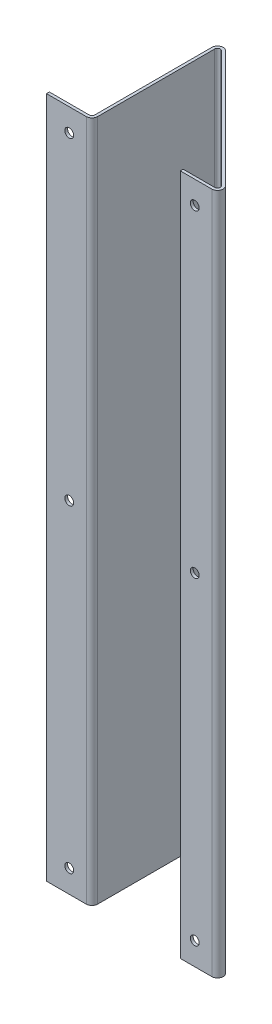
from build123d import *

# Parameters (mm, degrees)
BOSS_EXTRUDE1_DEPTH = 190.5
SKETCH2_R           = 2.4892
CUT_EXTRUDE1_DEPTH  = 225.347767066


with BuildPart() as part:
    # Sketch1 → Boss-Extrude1 (new, symmetric)
    with BuildSketch(Plane(origin=(0, 0, 0), x_dir=(1, 0, 0), z_dir=(0, 1, 0))):
        with BuildLine():
            Line((22.225, 1.5875), (0, 1.5875))
            Line((0, 1.5875), (0, 0))
            Line((0, 0), (22.225, 0))
            ThreePointArc((22.225, 0), (24.47006403, 0.92993597), (25.4, 3.175))
            Line((25.4, 3.175), (25.4, 68.534871939))
            ThreePointArc((25.4, 68.534871939), (26.379990051, 70.001530697), (28.110032015, 69.657403955))
            Line((28.110032015, 69.657403955), (93.469903955, 4.297532015))
            ThreePointArc((93.469903955, 4.297532015), (93.814030697, 2.567490051), (92.347371939, 1.5875))
            Line((92.347371939, 1.5875), (74.745381615, 1.5875))
            Line((74.745381615, 1.5875), (74.745381615, 0))
            Line((74.745381615, 0), (92.347371939, 0))
            ThreePointArc((92.347371939, 0), (95.280689455, 1.959980102), (94.59243597, 5.42006403))
            Line((94.59243597, 5.42006403), (29.23256403, 70.77993597))
            ThreePointArc((29.23256403, 70.77993597), (25.772480102, 71.468189455), (23.8125, 68.534871939))
            Line((23.8125, 68.534871939), (23.8125, 3.175))
            ThreePointArc((23.8125, 3.175), (23.347532015, 2.052467985), (22.225, 1.5875))
        make_face()
    extrude(amount=BOSS_EXTRUDE1_DEPTH, both=True)

    # Sketch2 → Cut-Extrude1 (cut, through all)
    with BuildSketch(Plane(origin=(0, 0, -1.5875), x_dir=(-1, 0, 0), z_dir=(0, 0, -1))):
        with Locations((-12.7, 177.8)):
            Circle(SKETCH2_R)
        with Locations((-12.7, 0)):
            Circle(SKETCH2_R)
        with Locations((-12.7, -177.8)):
            Circle(SKETCH2_R)
        with Locations((-82.822371939, 177.8)):
            Circle(SKETCH2_R)
        with Locations((-82.822371939, 0)):
            Circle(SKETCH2_R)
        with Locations((-82.822371939, -177.8)):
            Circle(SKETCH2_R)
    extrude(amount=-CUT_EXTRUDE1_DEPTH, mode=Mode.SUBTRACT)


solid = part.part
